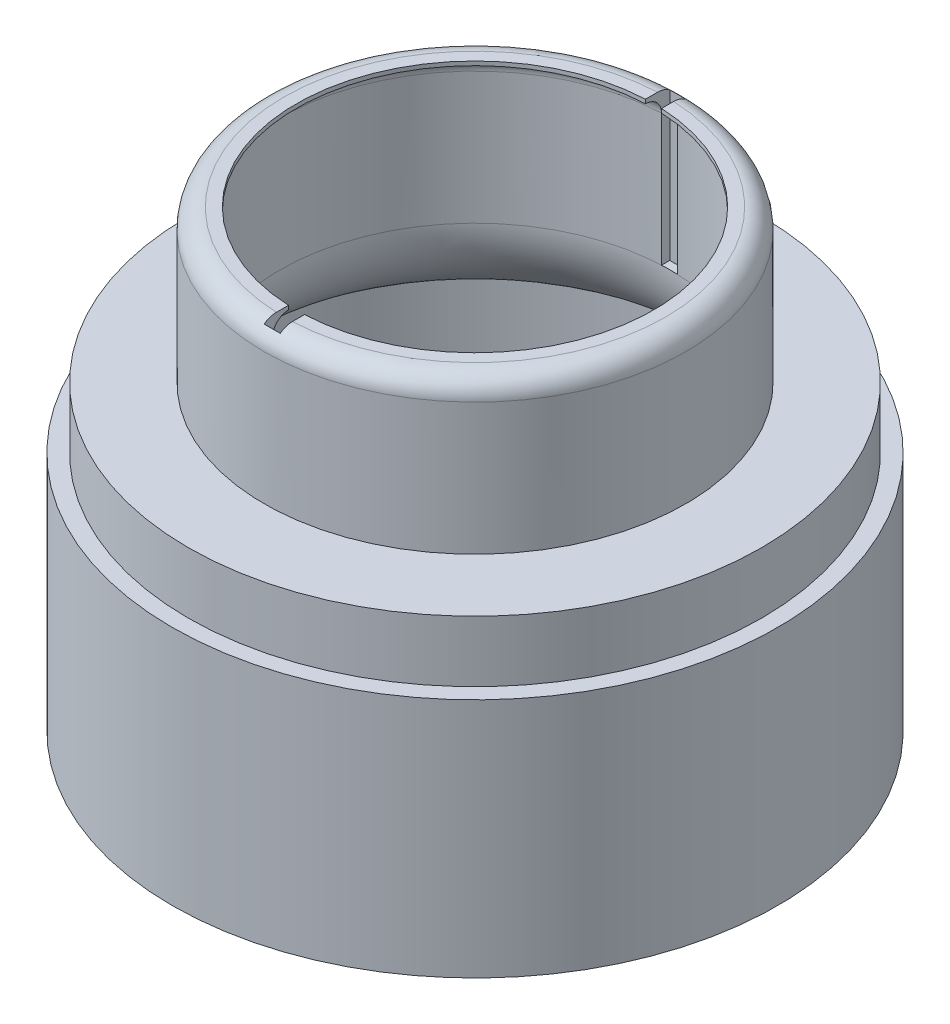
from build123d import *

# Parameters (mm, degrees)
SKETCH2_R               = 18.85
BOSS_EXTRUDE1_DEPTH     = 15
SKETCH4_R               = 17.85
CUT_EXTRUDE2_DEPTH      = 13
SKETCH5_R               = 13.125
BOSS_EXTRUDE2_DEPTH     = 12
SKETCH6_R               = 12.125
CUT_EXTRUDE3_DEPTH      = 38.942654098
CUT_EXTRUDE5_DEPTH      = 12
CUT_EXTRUDE5_DEPTH_BACK = 38.942654098
SKETCH11_W              = 1
SKETCH11_H              = 5
CUT_EXTRUDE7_DEPTH      = 31.711683494
BOSS_EXTRUDE4_START     = -5.8
SKETCH12_R              = 17.85
SKETCH12_R_2            = 12.125
BOSS_EXTRUDE4_DEPTH     = 5.8
FILLET3_R               = 5.8


with BuildPart() as part:
    # Sketch2 → Boss-Extrude1 (new body)
    with BuildSketch(Plane(origin=(0, 0, 0), x_dir=(1, 0, 0), z_dir=(0, 1, 0))):
        with Locations(Location((0, 0, 0), (0, 0, 270))):
            Circle(SKETCH2_R)
    extrude(amount=BOSS_EXTRUDE1_DEPTH)

    # Sketch4 → Cut-Extrude2 (cut)
    with BuildSketch(Plane(origin=(0, 0, 0), x_dir=(-1, 0, 0), z_dir=(0, -1, 0))):
        with Locations(Location((0, 0, 0), (0, 0, 90))):
            Circle(SKETCH4_R)
    extrude(amount=-CUT_EXTRUDE2_DEPTH, mode=Mode.SUBTRACT)

    # Sketch5 → Boss-Extrude2 (add)
    with BuildSketch(Plane(origin=(0, 15, 0), x_dir=(1, 0, 0), z_dir=(0, 1, 0))):
        with Locations(Location((0, 0, 0), (0, 0, 270))):
            Circle(SKETCH5_R)
    extrude(amount=BOSS_EXTRUDE2_DEPTH)

    # Sketch6 → Cut-Extrude3 (cut, through all)
    with BuildSketch(Plane(origin=(0, 27, 0), x_dir=(1, 0, 0), z_dir=(0, 1, 0))):
        with Locations(Location((0, 0, 0), (0, 0, 270))):
            Circle(SKETCH6_R)
    extrude(amount=-CUT_EXTRUDE3_DEPTH, mode=Mode.SUBTRACT)

    # Sketch7 → Cut-Extrude5 (cut, two sides: drawn at the far end of the back side and taken through both)
    with BuildSketch(Plane(origin=(0, 27, 0), x_dir=(1, 0, 0), z_dir=(0, 1, 0)).offset(-CUT_EXTRUDE5_DEPTH_BACK)):
        with BuildLine():
            ThreePointArc((-0.5, 12.114686335), (-0.25005318, 12.12242131), (0, 12.125))
            Line((0, 12.125), (0, 12.625))
            Line((0, 12.625), (-0.5, 12.625))
            Line((-0.5, 12.625), (-0.5, 12.114686335))
        make_face()
        with BuildLine():
            Line((0, 12.625), (0, 12.125))
            ThreePointArc((0, 12.125), (0.25005318, 12.12242131), (0.5, 12.114686335))
            Line((0.5, 12.114686335), (0.5, 12.625))
            Line((0.5, 12.625), (0, 12.625))
        make_face()
        with BuildLine():
            Line((0, -12.625), (0, -12.125))
            ThreePointArc((0, -12.125), (-0.25005318, -12.12242131), (-0.5, -12.114686335))
            Line((-0.5, -12.114686335), (-0.5, -12.625))
            Line((-0.5, -12.625), (0, -12.625))
        make_face()
        with BuildLine():
            ThreePointArc((0.5, -12.114686335), (0.25005318, -12.12242131), (0, -12.125))
            Line((0, -12.125), (0, -12.625))
            Line((0, -12.625), (0.5, -12.625))
            Line((0.5, -12.625), (0.5, -12.114686335))
        make_face()
    extrude(amount=CUT_EXTRUDE5_DEPTH + CUT_EXTRUDE5_DEPTH_BACK, mode=Mode.SUBTRACT)

    # Sketch8 → Revolve3 (revolve)
    with BuildSketch(Plane(origin=(0, 27, 0), x_dir=(0, 0, 1), z_dir=(-1, 0, 0))):
        with BuildLine():
            Line((-11.125, 1), (-11.125, 1.25))
            Line((-11.125, 1.25), (-11.875, 1.25))
            ThreePointArc((-11.875, 1.25), (-12.758883476, 0.883883476), (-13.125, 0))
            Line((-13.125, 0), (-12.125, 0))
            ThreePointArc((-12.125, 0), (-11.832106781, 0.707106781), (-11.125, 1))
        make_face()
    revolve(axis=Axis((0, 13, 0), (0, 1, 0)))

    # Sketch11 → Cut-Extrude7 (cut, through all)
    with BuildSketch(Plane.XZ.offset(-13)):
        with Locations((0, -10.125)):
            Rectangle(SKETCH11_W, SKETCH11_H)
        with Locations((0, 10.125)):
            Rectangle(SKETCH11_W, SKETCH11_H)
    extrude(amount=-CUT_EXTRUDE7_DEPTH, mode=Mode.SUBTRACT)

    # Sketch12 → Boss-Extrude4 (add)
    with BuildSketch(Plane(origin=(0, 13, 0), x_dir=(-1, 0, 0), z_dir=(0, -1, 0)).offset(BOSS_EXTRUDE4_START)):
        with Locations(Location((0, 0, 0), (0, 0, 90))):
            Circle(SKETCH12_R)
        with Locations(Location((0, 0, 0), (0, 0, 267.636617298))):
            Circle(SKETCH12_R_2, mode=Mode.SUBTRACT)
    extrude(amount=BOSS_EXTRUDE4_DEPTH)

    # Fillet3
    # the kernel refuses this fillet: 5.8 mm, written as the material it takes off along each edge
    with BuildSketch(Plane(origin=(0, 13, 0), x_dir=(0.04123711340209573, 0, 0.999149388469143), z_dir=(-0.999149388469143, 0, 0.04123711340209573))) as fillet3_piece_1_section:
        with BuildLine():
            CenterArc((12.125 + FILLET3_R, FILLET3_R), FILLET3_R, 180, 90)
            Line((12.125 + FILLET3_R, 0), (12.125, 0))
            Line((12.125, 0), (12.125, FILLET3_R))
        make_face()
    fillet3_piece_1 = revolve(axis=Axis((0, 13, 0), (0, 1, 0)), mode=Mode.PRIVATE)
    fillet3_piece_1 = fillet3_piece_1 & Plane(origin=(0, 14.662321343, 0), x_dir=(0, 0, -1), z_dir=(0, -1, 0)) * Cylinder(17.85, 72, mode=Mode.PRIVATE)
    add(fillet3_piece_1, mode=Mode.SUBTRACT)


solid = part.part
